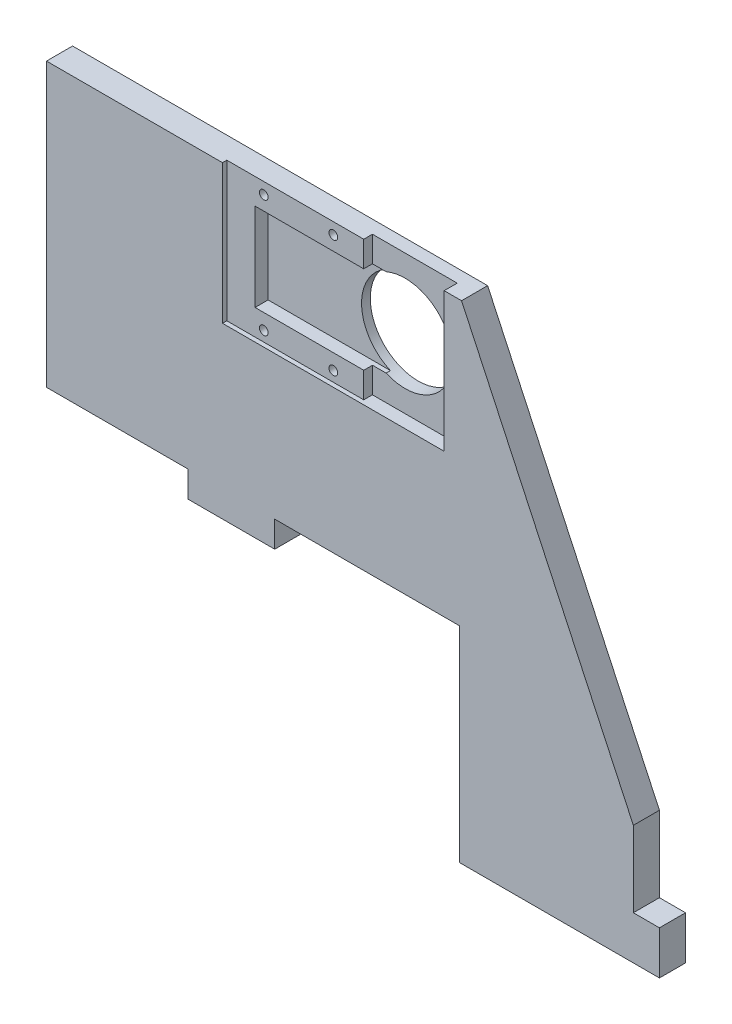
from build123d import *

# Parameters (mm, degrees)
ESQUISSE1_W             = 135
ESQUISSE1_H             = 112.17
BOSS_EXTRU_1_DEPTH      = 6
ENL_V_MAT_EXTRU_1_DEPTH = 6
ESQUISSE3_W             = 6
ESQUISSE3_H             = 10
ESQUISSE3_W_2           = 20
ESQUISSE3_H_2           = 6
BOSS_EXTRU_2_DEPTH      = 6
ESQUISSE4_W             = 51
ESQUISSE4_H             = 32
ENL_V_MAT_EXTRU_2_DEPTH = 3
ESQUISSE5_R             = 11
ENL_V_MAT_EXTRU_3_DEPTH = 93.502849821
ESQUISSE6_W             = 30
ESQUISSE6_H             = 20.2
ENL_V_MAT_EXTRU_4_DEPTH = 1
ESQUISSE7_W             = 25
ESQUISSE7_H             = 5.9
BOSS_EXTRU_3_DEPTH      = 2
ESQUISSE8_W             = 25
ESQUISSE8_H             = 5.9
BOSS_EXTRU_4_DEPTH      = 2
ESQUISSE9_W             = 6.5
ESQUISSE9_H             = 32
BOSS_EXTRU_5_DEPTH      = 2
ESQUISSE10_R            = 1
ENL_V_MAT_EXTRU_5_DEPTH = 93.589293253


with BuildPart() as part:
    # Esquisse1 → Boss.-Extru.1 (new body)
    with BuildSketch(Plane.XY):
        Rectangle(ESQUISSE1_W, ESQUISSE1_H)
    extrude(amount=BOSS_EXTRU_1_DEPTH)

    # Esquisse2 → Enlèv. mat.-Extru.1 (cut)
    with BuildSketch(Plane.XY.offset(6)):
        Polygon((27.5, -56.085), (-67.5, -56.085), (-67.5, -8.915), (-38.5, -8.915), (27.5, -8.915), align=None)
        Polygon((67.5, -28.665), (27.980425971, 56.085), (67.5, 56.085), align=None)
    extrude(amount=-ENL_V_MAT_EXTRU_1_DEPTH, mode=Mode.SUBTRACT)

    # Esquisse3 → Boss.-Extru.2 (add)
    with BuildSketch(Plane.XY.offset(6)):
        with Locations((70.5, -51.085)):
            Rectangle(ESQUISSE3_W, ESQUISSE3_H)
        with Locations((-25, -11.915)):
            Rectangle(ESQUISSE3_W_2, ESQUISSE3_H_2)
    extrude(amount=-BOSS_EXTRU_2_DEPTH)

    # Esquisse4 → Enlèv. mat.-Extru.2 (cut)
    with BuildSketch(Plane.XY.offset(6)):
        with Locations((-1.519574029, 40.085)):
            Rectangle(ESQUISSE4_W, ESQUISSE4_H)
    extrude(amount=-ENL_V_MAT_EXTRU_2_DEPTH, mode=Mode.SUBTRACT)

    # Esquisse5 → Enlèv. mat.-Extru.3 (cut, through all)
    with BuildSketch(Plane.XY.offset(3)):
        with Locations((11.980425971, 40.085)):
            Circle(ESQUISSE5_R)
    extrude(amount=-ENL_V_MAT_EXTRU_3_DEPTH, mode=Mode.SUBTRACT)

    # Esquisse6 → Enlèv. mat.-Extru.4 (cut)
    with BuildSketch(Plane.XY.offset(3)):
        with Locations((-5.519574029, 40.085)):
            Rectangle(ESQUISSE6_W, ESQUISSE6_H)
    extrude(amount=-ENL_V_MAT_EXTRU_4_DEPTH, mode=Mode.SUBTRACT)

    # Esquisse7 → Boss.-Extru.3 (add)
    with BuildSketch(Plane.XY.offset(3)):
        with Locations((-8.019574029, 53.135)):
            Rectangle(ESQUISSE7_W, ESQUISSE7_H)
    extrude(amount=BOSS_EXTRU_3_DEPTH)

    # Esquisse8 → Boss.-Extru.4 (add)
    with BuildSketch(Plane.XY.offset(3)):
        with Locations((-8.019574029, 27.035)):
            Rectangle(ESQUISSE8_W, ESQUISSE8_H)
    extrude(amount=BOSS_EXTRU_4_DEPTH)

    # Esquisse9 → Boss.-Extru.5 (add)
    with BuildSketch(Plane.XY.offset(3)):
        with Locations((-23.769574029, 40.085)):
            Rectangle(ESQUISSE9_W, ESQUISSE9_H)
    extrude(amount=BOSS_EXTRU_5_DEPTH)

    # Esquisse10 → Enlèv. mat.-Extru.5 (cut, through all)
    with BuildSketch(Plane.XY.offset(5)):
        with Locations((-18.519574029, 53.435)):
            Circle(ESQUISSE10_R)
        with Locations((-2.519574029, 53.435)):
            Circle(ESQUISSE10_R)
        with Locations((-18.519574029, 26.435)):
            Circle(ESQUISSE10_R)
        with Locations((-2.519574029, 26.435)):
            Circle(ESQUISSE10_R)
    extrude(amount=-ENL_V_MAT_EXTRU_5_DEPTH, mode=Mode.SUBTRACT)


solid = part.part
